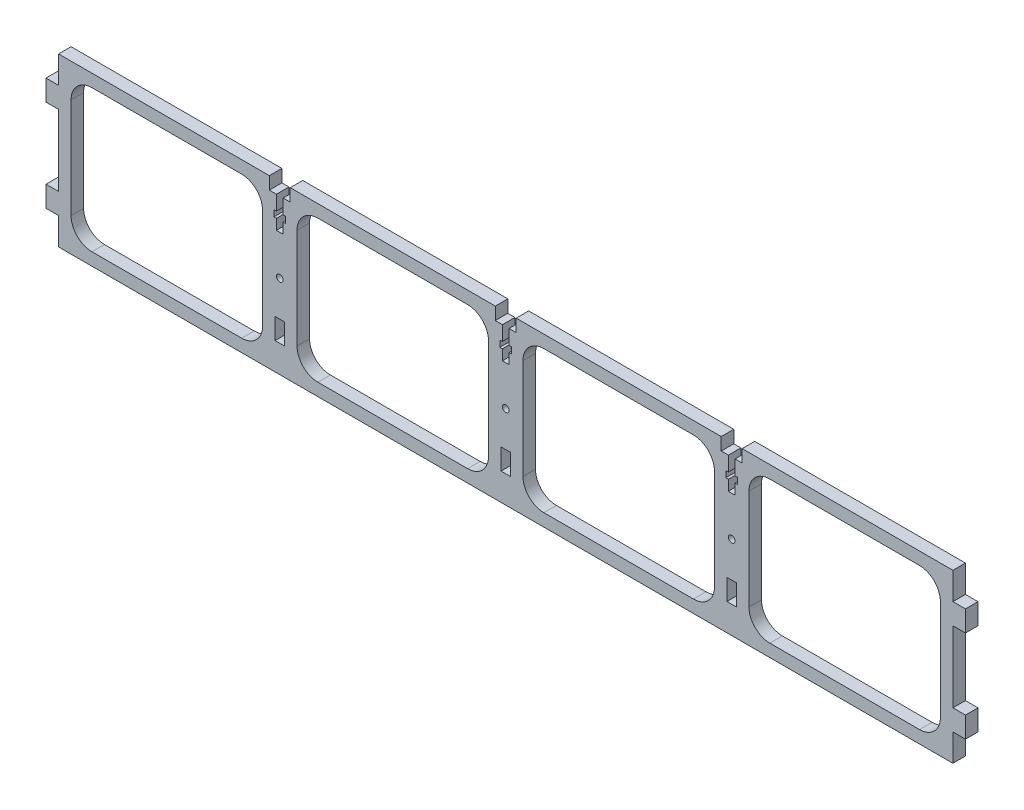
from build123d import *

# Parameters (mm, degrees)
SKETCH1_W           = 428
SKETCH1_H           = 80
BOSS_EXTRUDE1_DEPTH = 6
CUT_EXTRUDE1_REACH  = 219.789
LPATTERN1_COUNT     = 4
LPATTERN1_PITCH     = 108.125
SKETCH3_R           = 1.6
SKETCH3_W           = 4.5
SKETCH3_H           = 10
CUT_EXTRUDE2_DEPTH  = 218.788888605
SKETCH4_W           = 6
SKETCH4_H           = 10
BOSS_EXTRUDE2_DEPTH = 6
SKETCH5_W           = 10
SKETCH5_H           = 6
CUT_EXTRUDE3_DEPTH  = 6
CUT_EXTRUDE4_REACH  = 225.687


with BuildPart() as part:
    # Sketch1 → Boss-Extrude1 (new body)
    with BuildSketch(Plane.XY):
        Rectangle(SKETCH1_W, SKETCH1_H)
    extrude(amount=BOSS_EXTRUDE1_DEPTH)

    # Sketch2 → Cut-Extrude1 (cut, up to next)
    with BuildSketch(Plane.XY.offset(6), mode=Mode.PRIVATE) as cut_extrude1_sk1:
        with BuildLine():
            ThreePointArc((-126.375, -34), (-119.303932188, -31.071067812), (-116.375, -24))
            Line((-116.375, -24), (-116.375, 24))
            ThreePointArc((-116.375, 24), (-119.303932188, 31.071067812), (-126.375, 34))
            Line((-126.375, 34), (-198, 34))
            ThreePointArc((-198, 34), (-205.071067812, 31.071067812), (-208, 24))
            Line((-208, 24), (-208, -24))
            ThreePointArc((-208, -24), (-205.071067812, -31.071067812), (-198, -34))
            Line((-198, -34), (-126.375, -34))
        make_face()
    cut_extrude1_tool1 = extrude(cut_extrude1_sk1.sketch, amount=-CUT_EXTRUDE1_REACH, mode=Mode.PRIVATE) & part.part
    cut_extrude1 = cut_extrude1_tool1.solids().sort_by_distance((-162.1875, 0, 6))[0]
    add(cut_extrude1, mode=Mode.SUBTRACT)

    # LPattern1: Cut-Extrude1 ×4
    with Locations(*[(i * LPATTERN1_PITCH, 0, 0) for i in range(1, LPATTERN1_COUNT)]):
        add(cut_extrude1, mode=Mode.SUBTRACT)

    # Sketch3 → Cut-Extrude2 (cut, through all)
    with BuildSketch(Plane(origin=(0, 0, 0), x_dir=(-1, 0, 0), z_dir=(0, 0, -1))):
        with Locations((108.125, 0)):
            Circle(SKETCH3_R)
        Circle(SKETCH3_R)
        with Locations((-108.125, 0)):
            Circle(SKETCH3_R)
        with Locations((-108.125, -22)):
            Rectangle(SKETCH3_W, SKETCH3_H)
        with Locations((0, -22)):
            Rectangle(SKETCH3_W, SKETCH3_H)
        with Locations((108.125, -22)):
            Rectangle(SKETCH3_W, SKETCH3_H)
    extrude(amount=-CUT_EXTRUDE2_DEPTH, mode=Mode.SUBTRACT)

    # Sketch4 → Boss-Extrude2 (add)
    with BuildSketch(Plane(origin=(0, 0, 0), x_dir=(-1, 0, 0), z_dir=(0, 0, -1))):
        with Locations((-217, 22)):
            Rectangle(SKETCH4_W, SKETCH4_H)
        with Locations((-217, -22)):
            Rectangle(SKETCH4_W, SKETCH4_H)
        with Locations((217, -22)):
            Rectangle(SKETCH4_W, SKETCH4_H)
        with Locations((217, 22)):
            Rectangle(SKETCH4_W, SKETCH4_H)
    extrude(amount=-BOSS_EXTRUDE2_DEPTH)

    # Sketch5 → Cut-Extrude3 (cut)
    with BuildSketch(Plane(origin=(0, 40, 0), x_dir=(1, 0, 0), z_dir=(0, 1, 0))):
        with Locations((-108.125, -3)):
            Rectangle(SKETCH5_W, SKETCH5_H)
        with Locations((0, -3)):
            Rectangle(SKETCH5_W, SKETCH5_H)
        with Locations((108.125, -3)):
            Rectangle(SKETCH5_W, SKETCH5_H)
    extrude(amount=-CUT_EXTRUDE3_DEPTH, mode=Mode.SUBTRACT)

    # Sketch6 → Cut-Extrude4 (cut, up to next)
    with BuildSketch(Plane(origin=(0, 0, 0), x_dir=(-1, 0, 0), z_dir=(0, 0, -1)), mode=Mode.PRIVATE) as cut_extrude4_sk1:
        Polygon((-109.725, 34), (-109.725, 27), (-110.925, 27), (-110.925, 24), (-109.725, 24), (-109.725, 19), (-106.525, 19), (-106.525, 24), (-105.325, 24), (-105.325, 27), (-106.525, 27), (-106.525, 34), align=None)
    cut_extrude4_tool1 = extrude(cut_extrude4_sk1.sketch, amount=-CUT_EXTRUDE4_REACH, mode=Mode.PRIVATE) & part.part
    # Sketch6 → Cut-Extrude4 (cut, up to next)
    with BuildSketch(Plane(origin=(0, 0, 0), x_dir=(-1, 0, 0), z_dir=(0, 0, -1)), mode=Mode.PRIVATE) as cut_extrude4_sk2:
        Polygon((-1.595, 27), (-2.795, 27), (-2.795, 24), (-1.595, 24), (-1.595, 19), (1.605, 19), (1.605, 24), (2.805, 24), (2.805, 27), (1.605, 27), (1.605, 34), (-1.595, 34), align=None)
    cut_extrude4_tool2 = extrude(cut_extrude4_sk2.sketch, amount=-CUT_EXTRUDE4_REACH, mode=Mode.PRIVATE) & part.part
    # Sketch6 → Cut-Extrude4 (cut, up to next)
    with BuildSketch(Plane(origin=(0, 0, 0), x_dir=(-1, 0, 0), z_dir=(0, 0, -1)), mode=Mode.PRIVATE) as cut_extrude4_sk3:
        Polygon((106.535, 34), (106.535, 27), (105.335, 27), (105.335, 24), (106.535, 24), (106.535, 19), (109.735, 19), (109.735, 24), (110.935, 24), (110.935, 27), (109.735, 27), (109.735, 34), align=None)
    cut_extrude4_tool3 = extrude(cut_extrude4_sk3.sketch, amount=-CUT_EXTRUDE4_REACH, mode=Mode.PRIVATE) & part.part
    add(cut_extrude4_tool1.solids().sort_by_distance((108.125, 26.369565, 0))[0], mode=Mode.SUBTRACT)
    add(cut_extrude4_tool2.solids().sort_by_distance((-0.005, 26.369565, 0))[0], mode=Mode.SUBTRACT)
    add(cut_extrude4_tool3.solids().sort_by_distance((-108.135, 26.369565, 0))[0], mode=Mode.SUBTRACT)


solid = part.part
